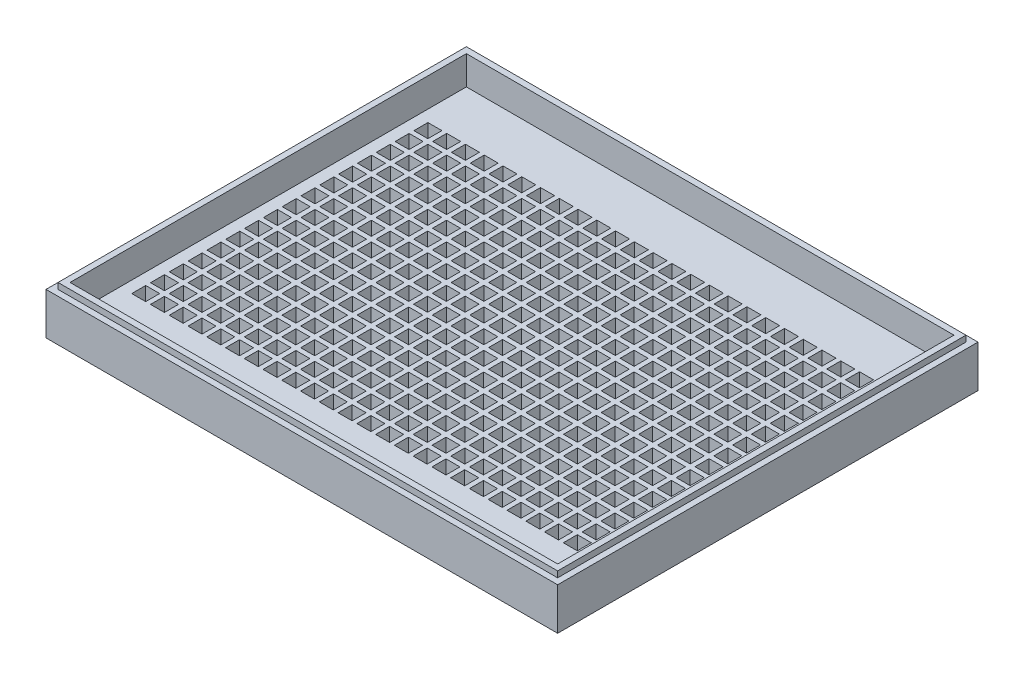
from build123d import *

# Parameters (mm, degrees)
SKETCH_1_W             = 85.2
SKETCH_1_H             = 70
EXTRUDE_1_DEPTH        = 8
SKETCH_2_W             = 85.2
SKETCH_2_H             = 70
SKETCH_2_W_2           = 83.2
SKETCH_2_H_2           = 68
CUT_EXTRUDE_1_DEPTH    = 1
SKETCH_3_W             = 81.2
SKETCH_3_H             = 66
CUT_EXTRUDE_2_DEPTH    = 7.8
SKETCH_5_W             = 78.4
SKETCH_5_H             = 0.8
EXTRUDE_3_DEPTH        = 3
PATTERN_LINEAR_1_COUNT = 17
PATTERN_LINEAR_1_PITCH = 3.133
SKETCH_6_W             = 0.8
SKETCH_6_H             = 50.928
EXTRUDE_4_DEPTH        = 3
PATTERN_LINEAR_2_COUNT = 26
PATTERN_LINEAR_2_PITCH = 3.125
SKETCH_7_W             = 81.2
SKETCH_7_H             = 66
SKETCH_7_W_2           = 78.925
SKETCH_7_H_2           = 50.928
EXTRUDE_5_DEPTH        = 3


with BuildPart() as part:
    # 草图1 → 凸台-拉伸1 (new body)
    with BuildSketch(Plane(origin=(0, 0, 0), x_dir=(1, 0, 0), z_dir=(0, 1, 0))):
        Rectangle(SKETCH_1_W, SKETCH_1_H)
    extrude(amount=EXTRUDE_1_DEPTH)

    # 草图2 → 切除-拉伸1 (cut)
    with BuildSketch(Plane(origin=(0, 8, 0), x_dir=(1, 0, 0), z_dir=(0, 1, 0))):
        Rectangle(SKETCH_2_W, SKETCH_2_H)
        Rectangle(SKETCH_2_W_2, SKETCH_2_H_2, mode=Mode.SUBTRACT)
    extrude(amount=-CUT_EXTRUDE_1_DEPTH, mode=Mode.SUBTRACT)

    # 草图3 → 切除-拉伸2 (cut)
    with BuildSketch(Plane(origin=(0, 8, 0), x_dir=(1, 0, 0), z_dir=(0, 1, 0))):
        Rectangle(SKETCH_3_W, SKETCH_3_H)
    extrude(amount=-CUT_EXTRUDE_2_DEPTH, mode=Mode.SUBTRACT)

    # 草图5 → 凸台-拉伸3 (add)
    with BuildSketch(Plane(origin=(0, 0.2, 0), x_dir=(1, 0, 0), z_dir=(0, 1, 0))):
        with Locations((-0.26, 25.06)):
            Rectangle(SKETCH_5_W, SKETCH_5_H)
    extrude_3 = extrude(amount=EXTRUDE_3_DEPTH)

    # 阵列(线性)1: 凸台-拉伸3 ×17
    with Locations(*[(0, 0, i * PATTERN_LINEAR_1_PITCH) for i in range(1, PATTERN_LINEAR_1_COUNT)]):
        add(extrude_3)

    # 草图6 → 凸台-拉伸4 (add)
    with BuildSketch(Plane(origin=(0, 0.2, 0), x_dir=(1, 0, 0), z_dir=(0, 1, 0))):
        with Locations((-39.06, -0.004)):
            Rectangle(SKETCH_6_W, SKETCH_6_H)
    extrude_4 = extrude(amount=EXTRUDE_4_DEPTH)

    # 阵列(线性)2: 凸台-拉伸4 ×26
    with Locations(*[(i * PATTERN_LINEAR_2_PITCH, 0, 0) for i in range(1, PATTERN_LINEAR_2_COUNT)]):
        add(extrude_4)

    # 草图7 → 凸台-拉伸5 (add)
    with BuildSketch(Plane(origin=(0, 0.2, 0), x_dir=(1, 0, 0), z_dir=(0, 1, 0))):
        Rectangle(SKETCH_7_W, SKETCH_7_H)
        with Locations((0.0025, -0.004)):
            Rectangle(SKETCH_7_W_2, SKETCH_7_H_2, mode=Mode.SUBTRACT)
    extrude(amount=EXTRUDE_5_DEPTH)


solid = part.part
